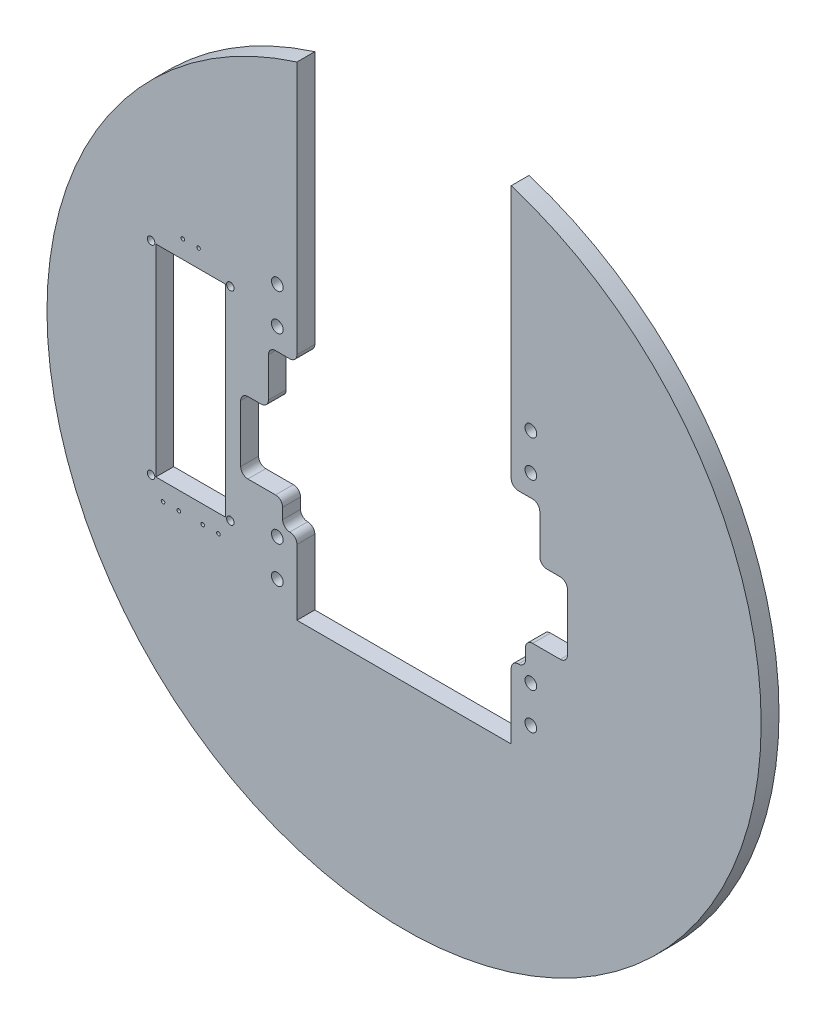
from build123d import *

# Parameters (mm, degrees)
BOSS_EXTRUDE1_DEPTH = 6.35
CUT_EXTRUDE1_REACH  = 210.789
SKETCH2_R           = 1.3335
SKETCH2_W           = 24.765
SKETCH2_H           = 71.755
CUT_EXTRUDE2_REACH  = 210.789
SKETCH3_R           = 0.635
CUT_EXTRUDE3_DEPTH  = 209.788828163
FILLET1_START       = -1
FILLET1_DEPTH       = 8
FILLET1_2_DEPTH     = 6.35
SKETCH5_R           = 2.0828
CUT_EXTRUDE4_DEPTH  = 209.788828163


with BuildPart() as part:
    # Sketch1 → Boss-Extrude1 (new body)
    with BuildSketch(Plane.XY):
        with BuildLine():
            Line((-38.1, 92.71), (-38.1, 165.60027858))
            ThreePointArc((-38.1, 165.60027858), (0, -82.55), (38.1, 165.60027858))
            Line((38.1, 165.60027858), (38.1, 92.71))
            Line((38.1, 92.71), (38.1, -6.35))
            Line((38.1, -6.35), (-38.1, -6.35))
            Line((-38.1, -6.35), (-38.1, 92.71))
        make_face()
    extrude(amount=BOSS_EXTRUDE1_DEPTH)

    # Sketch2 → Cut-Extrude1 (cut, up to next)
    with BuildSketch(Plane(origin=(0, 0, 0), x_dir=(-1, 0, 0), z_dir=(0, 0, -1)), mode=Mode.PRIVATE) as cut_extrude1_sk1:
        with Locations((61.7855, 12.5095)):
            Circle(SKETCH2_R)
    cut_extrude1_tool1 = extrude(cut_extrude1_sk1.sketch, amount=-CUT_EXTRUDE1_REACH, mode=Mode.PRIVATE) & part.part
    # Sketch2 → Cut-Extrude1 (cut, up to next)
    with BuildSketch(Plane(origin=(0, 0, 0), x_dir=(-1, 0, 0), z_dir=(0, 0, -1)), mode=Mode.PRIVATE) as cut_extrude1_sk2:
        with Locations((61.7855, 84.6455)):
            Circle(SKETCH2_R)
    cut_extrude1_tool2 = extrude(cut_extrude1_sk2.sketch, amount=-CUT_EXTRUDE1_REACH, mode=Mode.PRIVATE) & part.part
    # Sketch2 → Cut-Extrude1 (cut, up to next)
    with BuildSketch(Plane(origin=(0, 0, 0), x_dir=(-1, 0, 0), z_dir=(0, 0, -1)), mode=Mode.PRIVATE) as cut_extrude1_sk3:
        with Locations((89.9795, 84.6455)):
            Circle(SKETCH2_R)
    cut_extrude1_tool3 = extrude(cut_extrude1_sk3.sketch, amount=-CUT_EXTRUDE1_REACH, mode=Mode.PRIVATE) & part.part
    # Sketch2 → Cut-Extrude1 (cut, up to next)
    with BuildSketch(Plane(origin=(0, 0, 0), x_dir=(-1, 0, 0), z_dir=(0, 0, -1)), mode=Mode.PRIVATE) as cut_extrude1_sk4:
        with Locations((89.9795, 12.5095)):
            Circle(SKETCH2_R)
    cut_extrude1_tool4 = extrude(cut_extrude1_sk4.sketch, amount=-CUT_EXTRUDE1_REACH, mode=Mode.PRIVATE) & part.part
    # Sketch2 → Cut-Extrude1 (cut, up to next)
    with BuildSketch(Plane(origin=(0, 0, 0), x_dir=(-1, 0, 0), z_dir=(0, 0, -1)), mode=Mode.PRIVATE) as cut_extrude1_sk5:
        with Locations((75.8825, 48.5775)):
            Rectangle(SKETCH2_W, SKETCH2_H)
    cut_extrude1_tool5 = extrude(cut_extrude1_sk5.sketch, amount=-CUT_EXTRUDE1_REACH, mode=Mode.PRIVATE) & part.part
    add(cut_extrude1_tool1.solids().sort_by_distance((-61.7855, 12.5095, 0))[0], mode=Mode.SUBTRACT)
    add(cut_extrude1_tool2.solids().sort_by_distance((-61.7855, 84.6455, 0))[0], mode=Mode.SUBTRACT)
    add(cut_extrude1_tool3.solids().sort_by_distance((-89.9795, 84.6455, 0))[0], mode=Mode.SUBTRACT)
    add(cut_extrude1_tool4.solids().sort_by_distance((-89.9795, 12.5095, 0))[0], mode=Mode.SUBTRACT)
    add(cut_extrude1_tool5.solids().sort_by_distance((-75.8825, 48.5775, 0))[0], mode=Mode.SUBTRACT)

    # Sketch3 → Cut-Extrude2 (cut, up to next)
    with BuildSketch(Plane.XY.offset(6.35), mode=Mode.PRIVATE) as cut_extrude2_sk1:
        with Locations((-66.04, 6.35)):
            Circle(SKETCH3_R)
    cut_extrude2_tool1 = extrude(cut_extrude2_sk1.sketch, amount=-CUT_EXTRUDE2_REACH, mode=Mode.PRIVATE) & part.part
    # Sketch3 → Cut-Extrude2 (cut, up to next)
    with BuildSketch(Plane.XY.offset(6.35), mode=Mode.PRIVATE) as cut_extrude2_sk2:
        with Locations((-71.628, 6.35)):
            Circle(SKETCH3_R)
    cut_extrude2_tool2 = extrude(cut_extrude2_sk2.sketch, amount=-CUT_EXTRUDE2_REACH, mode=Mode.PRIVATE) & part.part
    # Sketch3 → Cut-Extrude2 (cut, up to next)
    with BuildSketch(Plane.XY.offset(6.35), mode=Mode.PRIVATE) as cut_extrude2_sk3:
        with Locations((-80.137, 6.35)):
            Circle(SKETCH3_R)
    cut_extrude2_tool3 = extrude(cut_extrude2_sk3.sketch, amount=-CUT_EXTRUDE2_REACH, mode=Mode.PRIVATE) & part.part
    # Sketch3 → Cut-Extrude2 (cut, up to next)
    with BuildSketch(Plane.XY.offset(6.35), mode=Mode.PRIVATE) as cut_extrude2_sk4:
        with Locations((-85.725, 6.35)):
            Circle(SKETCH3_R)
    cut_extrude2_tool4 = extrude(cut_extrude2_sk4.sketch, amount=-CUT_EXTRUDE2_REACH, mode=Mode.PRIVATE) & part.part
    # Sketch3 → Cut-Extrude2 (cut, up to next)
    with BuildSketch(Plane.XY.offset(6.35), mode=Mode.PRIVATE) as cut_extrude2_sk5:
        with Locations((-73.0885, 90.805)):
            Circle(SKETCH3_R)
    cut_extrude2_tool5 = extrude(cut_extrude2_sk5.sketch, amount=-CUT_EXTRUDE2_REACH, mode=Mode.PRIVATE) & part.part
    # Sketch3 → Cut-Extrude2 (cut, up to next)
    with BuildSketch(Plane.XY.offset(6.35), mode=Mode.PRIVATE) as cut_extrude2_sk6:
        with Locations((-78.6765, 90.805)):
            Circle(SKETCH3_R)
    cut_extrude2_tool6 = extrude(cut_extrude2_sk6.sketch, amount=-CUT_EXTRUDE2_REACH, mode=Mode.PRIVATE) & part.part
    add(cut_extrude2_tool1.solids().sort_by_distance((-66.04, 6.35, 6.35))[0], mode=Mode.SUBTRACT)
    add(cut_extrude2_tool2.solids().sort_by_distance((-71.628, 6.35, 6.35))[0], mode=Mode.SUBTRACT)
    add(cut_extrude2_tool3.solids().sort_by_distance((-80.137, 6.35, 6.35))[0], mode=Mode.SUBTRACT)
    add(cut_extrude2_tool4.solids().sort_by_distance((-85.725, 6.35, 6.35))[0], mode=Mode.SUBTRACT)
    add(cut_extrude2_tool5.solids().sort_by_distance((-73.0885, 90.805, 6.35))[0], mode=Mode.SUBTRACT)
    add(cut_extrude2_tool6.solids().sort_by_distance((-78.6765, 90.805, 6.35))[0], mode=Mode.SUBTRACT)

    # Sketch4 → Cut-Extrude3 (cut, through all)
    with BuildSketch(Plane.XY.offset(6.35)):
        Polygon((-48.26, 72.898), (-48.26, 53.848), (-58.1, 53.848), (-58.1, 28.448), (-43.18, 28.448), (-43.18, 19.558), (-38.1, 19.558), (-38.1, 72.898), align=None)
        Polygon((43.18, 28.448), (58.1, 28.448), (58.1, 53.848), (48.26, 53.848), (48.26, 72.898), (38.1, 72.898), (38.1, 19.558), (43.18, 19.558), align=None)
    extrude(amount=-CUT_EXTRUDE3_DEPTH, mode=Mode.SUBTRACT)

    # Fillet1: read off the stored shape, not the designer's step
    # Fillet1 outline → Fillet1 (cut)
    with BuildSketch(Plane.XY.offset(FILLET1_START)):
        with BuildLine():
            Line((38.1, 72.898), (40.64, 72.898))
            ThreePointArc((40.64, 72.898), (38.843948776, 73.641948776), (38.1, 75.438))
            Line((38.1, 75.438), (38.1, 72.898))
        make_face()
        with BuildLine():
            Line((48.26, 53.848), (50.8, 53.848))
            ThreePointArc((50.8, 53.848), (49.003948776, 54.591948776), (48.26, 56.388))
            Line((48.26, 56.388), (48.26, 53.848))
        make_face()
        with BuildLine():
            Line((43.18, 28.448), (43.18, 25.908))
            ThreePointArc((43.18, 25.908), (43.923948776, 27.704051224), (45.72, 28.448))
            Line((45.72, 28.448), (43.18, 28.448))
        make_face()
        with BuildLine():
            ThreePointArc((38.1, 17.018), (38.843948776, 18.814051224), (40.64, 19.558))
            Line((40.64, 19.558), (38.1, 19.558))
            Line((38.1, 19.558), (38.1, 17.018))
        make_face()
        with BuildLine():
            Line((-38.1, 19.558), (-40.64, 19.558))
            ThreePointArc((-40.64, 19.558), (-38.843948776, 18.814051224), (-38.1, 17.018))
            Line((-38.1, 17.018), (-38.1, 19.558))
        make_face()
        with BuildLine():
            ThreePointArc((-38.1, 75.438), (-38.843948776, 73.641948776), (-40.64, 72.898))
            Line((-40.64, 72.898), (-38.1, 72.898))
            Line((-38.1, 72.898), (-38.1, 75.438))
        make_face()
        with BuildLine():
            ThreePointArc((-48.26, 56.388), (-49.003948776, 54.591948776), (-50.8, 53.848))
            Line((-50.8, 53.848), (-48.26, 53.848))
            Line((-48.26, 53.848), (-48.26, 56.388))
        make_face()
        with BuildLine():
            ThreePointArc((-45.72, 28.448), (-43.923948776, 27.704051224), (-43.18, 25.908))
            Line((-43.18, 25.908), (-43.18, 28.448))
            Line((-43.18, 28.448), (-45.72, 28.448))
        make_face()
    extrude(amount=FILLET1_DEPTH, mode=Mode.SUBTRACT)

    # Fillet1 2 outline → Fillet1 2 (add)
    with BuildSketch(Plane.XY):
        with BuildLine():
            Line((43.18, 19.558), (43.18, 22.098))
            ThreePointArc((43.18, 22.098), (42.436051224, 20.301948776), (40.64, 19.558))
            Line((40.64, 19.558), (43.18, 19.558))
        make_face()
        with BuildLine():
            ThreePointArc((45.72, 72.898), (47.516051224, 72.154051224), (48.26, 70.358))
            Line((48.26, 70.358), (48.26, 72.898))
            Line((48.26, 72.898), (45.72, 72.898))
        make_face()
        with BuildLine():
            ThreePointArc((55.56, 53.848), (57.356051224, 53.104051224), (58.1, 51.308))
            Line((58.1, 51.308), (58.1, 53.848))
            Line((58.1, 53.848), (55.56, 53.848))
        make_face()
        with BuildLine():
            ThreePointArc((58.1, 30.988), (57.356051224, 29.191948776), (55.56, 28.448))
            Line((55.56, 28.448), (58.1, 28.448))
            Line((58.1, 28.448), (58.1, 30.988))
        make_face()
        with BuildLine():
            Line((-43.18, 19.558), (-40.64, 19.558))
            ThreePointArc((-40.64, 19.558), (-42.436051224, 20.301948776), (-43.18, 22.098))
            Line((-43.18, 22.098), (-43.18, 19.558))
        make_face()
        with BuildLine():
            Line((-48.26, 72.898), (-48.26, 70.358))
            ThreePointArc((-48.26, 70.358), (-47.516051224, 72.154051224), (-45.72, 72.898))
            Line((-45.72, 72.898), (-48.26, 72.898))
        make_face()
        with BuildLine():
            Line((-58.1, 53.848), (-58.1, 51.308))
            ThreePointArc((-58.1, 51.308), (-57.356051224, 53.104051224), (-55.56, 53.848))
            Line((-55.56, 53.848), (-58.1, 53.848))
        make_face()
        with BuildLine():
            Line((-58.1, 28.448), (-55.56, 28.448))
            ThreePointArc((-55.56, 28.448), (-57.356051224, 29.191948776), (-58.1, 30.988))
            Line((-58.1, 30.988), (-58.1, 28.448))
        make_face()
    extrude(amount=FILLET1_2_DEPTH)

    # Sketch5 → Cut-Extrude4 (cut, through all)
    with BuildSketch(Plane.XY.offset(6.35)):
        with Locations((-45.085, 80.645)):
            Circle(SKETCH5_R)
        with Locations(Location((45.085, 80.645, 0), (0, 0, 180))):
            Circle(SKETCH5_R)
        with Locations((45.085, 15.875)):
            Circle(SKETCH5_R)
        with Locations(Location((-45.085, 15.875, 0), (0, 0, 180))):
            Circle(SKETCH5_R)
        with Locations((-45.085, 93.6625)):
            Circle(SKETCH5_R)
        with Locations(Location((45.085, 93.6625, 0), (0, 0, 180))):
            Circle(SKETCH5_R)
        with Locations((45.085, 2.8575)):
            Circle(SKETCH5_R)
        with Locations(Location((-45.085, 2.8575, 0), (0, 0, 180))):
            Circle(SKETCH5_R)
    extrude(amount=-CUT_EXTRUDE4_DEPTH, mode=Mode.SUBTRACT)


solid = part.part
